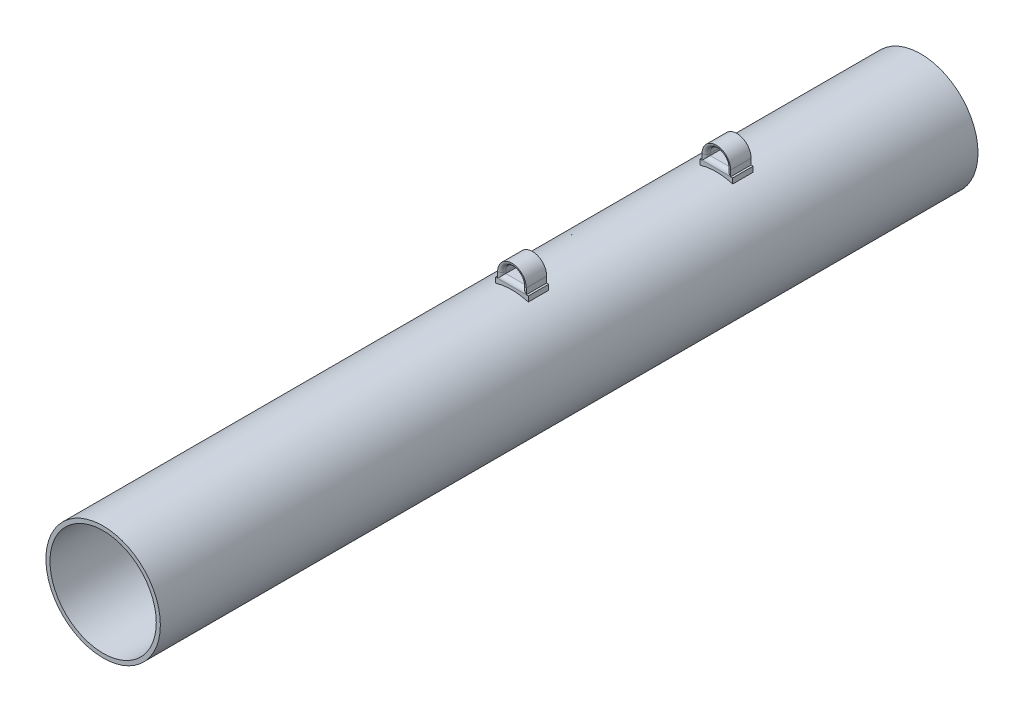
from build123d import *

# Parameters (mm, degrees)
CROQUIS1_R                 = 14
SALIENTE_EXTRUIR1_DEPTH    = 200
CORTAR_EXTRUIR1_DEPTH      = 201.977610693
CORTAR_EXTRUIR1_DEPTH_BACK = 201.977610693
CROQUIS2_R                 = 13
CROQUIS3_W                 = 8
CROQUIS3_H                 = 1.4
SALIENTE_EXTRUIR2_DEPTH    = 5
EXTRUIR_L_MINA2_DEPTH      = 5
CROQUIS6_W                 = 5
CROQUIS6_H                 = 5
SALIENTE_EXTRUIR3_DEPTH    = 1
REDONDEO1_R                = 1
MATRIZL2_COUNT             = 2
MATRIZL2_PITCH             = 50
REDONDEO1_OF_MATRIZL2_R    = 1
CROQUIS8_R                 = 13.5
CORTAR_EXTRUIR2_DEPTH      = 50


with BuildPart() as part:
    # Croquis1 → Saliente-Extruir1 (new body)
    with BuildSketch(Plane.XY):
        Circle(CROQUIS1_R)
    extrude(amount=-SALIENTE_EXTRUIR1_DEPTH)

    # Croquis2 → Cortar-Extruir1 (cut, two sides: drawn at the far end of the back side and taken through both)
    with BuildSketch(Plane.XY.offset(-CORTAR_EXTRUIR1_DEPTH_BACK)):
        Circle(CROQUIS2_R)
    extrude(amount=CORTAR_EXTRUIR1_DEPTH + CORTAR_EXTRUIR1_DEPTH_BACK, mode=Mode.SUBTRACT)

    # Croquis3 → Saliente-Extruir2 (add)
    with BuildSketch(Plane.XY.offset(-100)):
        with Locations((0, 14)):
            Rectangle(CROQUIS3_W, CROQUIS3_H)
    saliente_extruir2 = extrude(amount=-SALIENTE_EXTRUIR2_DEPTH)

    # Croquis5 → Extruir-Lámina2 (add)
    with BuildSketch(Plane.XY.offset(-100)):
        with BuildLine():
            Line((-3.5, 16.142129337), (-3.5, 15.7))
            Line((-3.5, 15.7), (-3.5, 13.7))
            Line((-3.5, 13.7), (3.5, 13.7))
            Line((3.5, 13.7), (3.5, 16.142129337))
            ThreePointArc((3.5, 16.142129337), (0, 19.642129337), (-3.5, 16.142129337))
        make_face()
        with BuildLine():
            Line((-2.5, 16.142129337), (-2.5, 15.7))
            Line((-2.5, 15.7), (-2.5, 14.7))
            Line((-2.5, 14.7), (2.5, 14.7))
            Line((2.5, 14.7), (2.5, 16.142129337))
            ThreePointArc((2.5, 16.142129337), (0, 18.642129337), (-2.5, 16.142129337))
        make_face(mode=Mode.SUBTRACT)
    extruir_l_mina2 = extrude(amount=-EXTRUIR_L_MINA2_DEPTH)

    # Croquis6 → Saliente-Extruir3 (add)
    with BuildSketch(Plane(origin=(0, 14.7, 0), x_dir=(1, 0, 0), z_dir=(0, 1, 0))):
        with Locations((0, 102.5)):
            Rectangle(CROQUIS6_W, CROQUIS6_H)
    saliente_extruir3 = extrude(amount=SALIENTE_EXTRUIR3_DEPTH)

    # Redondeo1
    redondeo1_edges = [part.edges().sort_by_distance(p)[0] for p in [
        (-2.5, 15.921064668, -100),
        (0, 18.642129337, -100),
        (0, 18.642129337, -105),
        (-2.5, 15.921064668, -105),
        (2.5, 15.921064668, -105),
        (2.5, 15.921064668, -100),
        (0, 15.7, -105),
        (0, 15.7, -100),
    ]]
    fillet(redondeo1_edges, radius=REDONDEO1_R - 0.0001)  # a hair under: the kernel refuses the full size

    # MatrizL2: Saliente-Extruir2, Extruir-Lámina2, Saliente-Extruir3 ×2
    with Locations(*[(0, 0, -i * MATRIZL2_PITCH) for i in range(1, MATRIZL2_COUNT)]):
        add(saliente_extruir2)
        add(extruir_l_mina2)
        add(saliente_extruir3)

    # Redondeo1 of MatrizL2
    redondeo1_of_matrizl2_edges = [part.edges().sort_by_distance(p)[0] for p in [
        (-2.5, 15.921064668, -150),
        (0, 18.642129337, -150),
        (0, 18.642129337, -155),
        (-2.5, 15.921064668, -155),
        (2.5, 15.921064668, -155),
        (2.5, 15.921064668, -150),
        (0, 15.7, -155),
        (0, 15.7, -150),
    ]]
    fillet(redondeo1_of_matrizl2_edges, radius=REDONDEO1_OF_MATRIZL2_R - 0.0001)  # a hair under: the kernel refuses the full size

    # Croquis8 → Cortar-Extruir2 (cut)
    with BuildSketch(Plane(origin=(0, 0, -200), x_dir=(-1, 0, 0), z_dir=(0, 0, -1))):
        Circle(CROQUIS8_R)
    extrude(amount=-CORTAR_EXTRUIR2_DEPTH, mode=Mode.SUBTRACT)


solid = part.part
